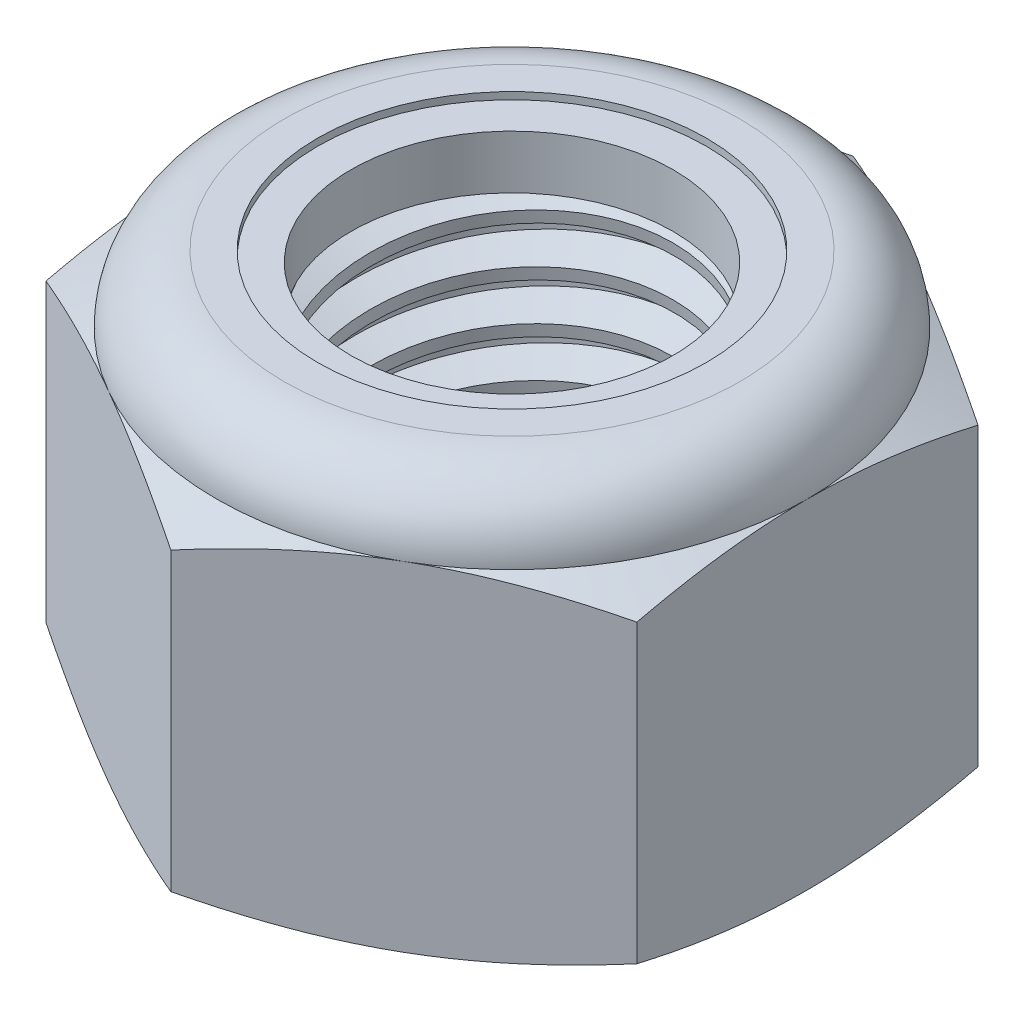
from build123d import *

# Parameters (mm, degrees)
EXTRUDE1_DEPTH       = 8.73125
SKETCH2_W            = 3.96875
SKETCH2_H            = 8.73125
LPATTERN1_COUNT      = 8
LPATTERN1_PITCH      = 1.058333333
LPATTERN1_COUNT_DIR2 = 2
LPATTERN1_PITCH_DIR2 = 1.058333333


with BuildPart() as part:
    # Sketch1 → Extrude1 (new body)
    with BuildSketch(Plane(origin=(0, 0, 0), x_dir=(1, 0, 0), z_dir=(0, 1, 0))):
        Polygon((0, 7.332348419), (-6.35, 3.666174209), (-6.35, -3.666174209), (0, -7.332348419), (6.35, -3.666174209), (6.35, 3.666174209), align=None)
    extrude(amount=EXTRUDE1_DEPTH)

    # Sketch4 → Cut-Revolve2 (revolve, cut)
    with BuildSketch(Plane(origin=(0, 0, 0), x_dir=(0, 0, -1), z_dir=(1, 0, 0))):
        Polygon((0, 8.73125), (3.96875, 8.73125), (3.462129843, 8.495009141), (3.462129843, 0.236240859), (3.96875, 0), (0, 0), align=None)
    revolve(axis=Axis((0, 8.73125, 0), (0, 1, 0)), mode=Mode.SUBTRACT)


with BuildPart() as body_2:
    # Sketch2 → Revolve1 (revolve)
    with BuildSketch(Plane(origin=(0, 0, 0), x_dir=(0, 0, -1), z_dir=(1, 0, 0))):
        with Locations((1.984375, 4.365625)):
            Rectangle(SKETCH2_W, SKETCH2_H)
    revolve(axis=Axis((0, -3.96875, 0), (0, 1, 0)))

    # Sketch3 → Cut-Revolve1 (revolve, cut)
    with BuildSketch(Plane(origin=(0, 0, 0), x_dir=(0, 0, -1), z_dir=(1, 0, 0))):
        Polygon((3.986234159, 8.600118809), (4.10862327, 7.682200472), (3.49709816, 7.934319821), (3.462129843, 8.196582203), align=None)
    cut_revolve1 = revolve(axis=Axis((0, 8.73125, 0.150633003), (0, -0.9912279006826347, -0.1321637200910183)), mode=Mode.SUBTRACT)

    # LPattern1: Cut-Revolve1 8 × 2
    with Locations(*[Vector(0, -1, 0) * (i * LPATTERN1_PITCH) + Vector(0, 1, 0) * (j * LPATTERN1_PITCH_DIR2) for i in range(LPATTERN1_COUNT) for j in range(LPATTERN1_COUNT_DIR2) if (i, j) != (0, 0)]):
        add(cut_revolve1, mode=Mode.SUBTRACT)


with BuildPart() as part_1:
    add(part.part)

    # Combine1: cut body 2
    add(body_2.part, mode=Mode.SUBTRACT)

    # Sketch5 → Cut-Revolve3 (revolve, cut)
    with BuildSketch(Plane(origin=(0, 0, 0), x_dir=(0, 0, -1), z_dir=(1, 0, 0))):
        with BuildLine():
            Line((0, 0), (6.35, 0))
            Line((6.35, 0), (7.332348419, 0.458076591))
            Line((7.332348419, 0.458076591), (7.332348419, 6.817965076))
            Line((7.332348419, 6.817965076), (6.35, 7.276041667))
            ThreePointArc((6.35, 7.276041667), (5.923779347, 8.305029347), (4.894791667, 8.73125))
            Line((4.894791667, 8.73125), (4.894791667, 10.00125))
            Line((4.894791667, 10.00125), (8.602348419, 10.00125))
            Line((8.602348419, 10.00125), (8.602348419, -1.27))
            Line((8.602348419, -1.27), (0, -1.27))
            Line((0, -1.27), (0, 0))
        make_face()
    revolve(axis=Axis((0, 0, 0), (0, 1, 0)), mode=Mode.SUBTRACT)

    # Sketch6 → Cut-Revolve4 (revolve, cut)
    with BuildSketch(Plane(origin=(0, 0, 0), x_dir=(0, 0, -1), z_dir=(1, 0, 0))):
        with BuildLine():
            Line((0, 7.276041667), (6.1976, 7.276041667))
            ThreePointArc((6.1976, 7.276041667), (5.816016274, 8.197266274), (4.894791667, 8.57885))
            Line((4.894791667, 8.57885), (4.178460755, 8.57885))
            Line((4.178460755, 8.57885), (4.178460755, 10.00125))
            Line((4.178460755, 10.00125), (0, 10.00125))
            Line((0, 10.00125), (0, 7.276041667))
        make_face()
    revolve(axis=Axis((0, 10.00125, 0), (0, 1, 0)), mode=Mode.SUBTRACT)


with BuildPart() as body_2_2:
    # Sketch7 → Revolve2 (revolve)
    with BuildSketch(Plane(origin=(0, 0, 0), x_dir=(0, 0, -1), z_dir=(1, 0, 0))):
        with BuildLine():
            Line((3.462129843, 7.352241667), (6.119030844, 7.352241667))
            ThreePointArc((6.119030844, 7.352241667), (5.734762038, 8.169919611), (4.894791667, 8.50265))
            Line((4.894791667, 8.50265), (3.462129843, 8.50265))
            Line((3.462129843, 8.50265), (3.462129843, 7.352241667))
        make_face()
    revolve(axis=Axis((0, 7.352241667, 0), (0, 1, 0)))


solid = Compound([part_1.part, body_2_2.part])
